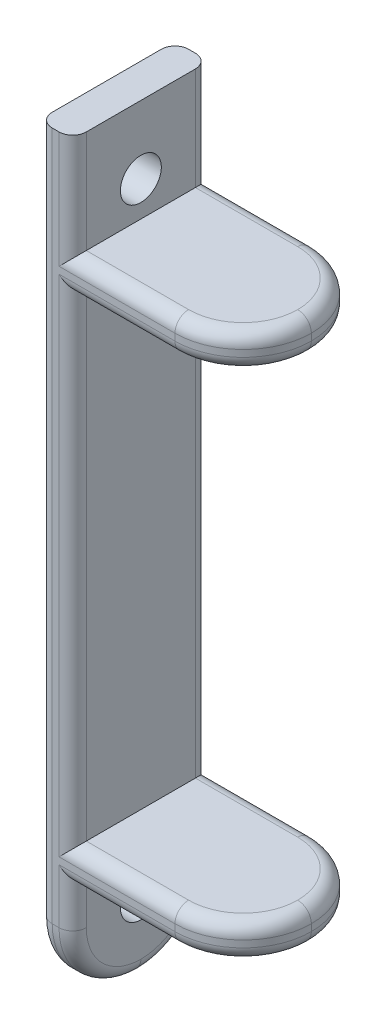
from build123d import *

# Parameters (mm, degrees)
BOSS_EXTRUDE1_DEPTH = 20
SKETCH2_R           = 3
CUT_EXTRUDE1_DEPTH  = 20
FILLET1_R           = 10
FILLET2_R           = 2
CUT_EXTRUDE2_DEPTH  = 10


with BuildPart() as part:
    # Sketch1 → Boss-Extrude1 (new body)
    with BuildSketch(Plane.XY):
        Polygon((0, 0), (5, 0), (5, 10), (5, 16), (30, 16), (30, 21), (5, 21), (5, 91), (30, 91), (30, 96), (5, 96), (5, 170), (0, 170), align=None)
    extrude(amount=BOSS_EXTRUDE1_DEPTH)

    # Sketch2 → Cut-Extrude1 (cut)
    with BuildSketch(Plane.ZY):
        with Locations((10, 10)):
            Circle(SKETCH2_R)
        with Locations((10, 101.100788163)):
            Circle(SKETCH2_R)
    extrude(amount=-CUT_EXTRUDE1_DEPTH, mode=Mode.SUBTRACT)

    # Fillet1
    fillet1_edges = [part.edges().sort_by_distance(p)[0] for p in [
        (2.5, 170, 20),
        (2.5, 170, 0),
        (2.5, 0, 0),
        (2.5, 0, 20),
        (30, 18.5, 20),
        (30, 18.5, 0),
        (30, 93.5, 0),
        (30, 93.5, 20),
    ]]
    fillet(fillet1_edges, radius=FILLET1_R - 0.0001)  # a hair under: the kernel refuses the full size

    # Fillet2
    fillet2_edges = [part.edges().sort_by_distance(p)[0] for p in [
        (5, 56, 0),
        (12.50005, 16, 0),
        (12.50005, 96, 20),
        (5, 128.00005, 0),
        (12.50005, 96, 0),
        (12.50005, 91, 0),
        (5, 128.00005, 20),
        (12.50005, 16, 20),
        (5, 167.071097101, 2.928902899),
        (5, 167.071097101, 17.071097101),
        (0, 85, 20),
        (5, 12.99995, 20),
        (12.50005, 21, 20),
        (0, 85, 0),
        (0, 2.928902899, 17.071097101),
        (0, 2.928902899, 2.928902899),
        (0, 167.071097101, 2.928902899),
        (0, 167.071097101, 17.071097101),
        (12.50005, 91, 20),
        (12.50005, 21, 0),
        (5, 12.99995, 0),
        (5, 2.928902899, 17.071097101),
        (5, 56, 20),
        (5, 2.928902899, 2.928902899),
        (27.071097101, 21, 2.928902899),
        (27.071097101, 21, 17.071097101),
        (27.071097101, 16, 2.928902899),
        (27.071097101, 16, 17.071097101),
        (27.071097101, 96, 17.071097101),
        (27.071097101, 96, 2.928902899),
        (27.071097101, 91, 17.071097101),
        (27.071097101, 91, 2.928902899),
    ]]
    fillet(fillet2_edges, radius=FILLET2_R)

    # Sketch3 → Cut-Extrude2 (cut)
    with BuildSketch(Plane(origin=(5, 0, 0), x_dir=(0, 0, -1), z_dir=(1, 0, 0))):
        with BuildLine():
            Line((-2, 111.064309568), (0, 111.064309568))
            Line((0, 111.064309568), (5.411818178, 111.064309568))
            Line((5.411818178, 111.064309568), (5.411818178, 180.556551252))
            Line((5.411818178, 180.556551252), (-29.02399195, 180.556551252))
            Line((-29.02399195, 180.556551252), (-29.02399195, 111.064309568))
            Line((-29.02399195, 111.064309568), (-20, 111.064309568))
            Line((-20, 111.064309568), (-18, 111.064309568))
            Line((-18, 111.064309568), (-18, 160))
            ThreePointArc((-18, 160), (-15.656854249, 165.656854249), (-10, 168))
            ThreePointArc((-10, 168), (-4.343145751, 165.656854249), (-2, 160))
            Line((-2, 160), (-2, 111.064309568))
        make_face()
        with BuildLine():
            Line((-18, 111.064309568), (-2, 111.064309568))
            Line((-2, 111.064309568), (-2, 160))
            ThreePointArc((-2, 160), (-4.343145751, 165.656854249), (-10, 168))
            ThreePointArc((-10, 168), (-15.656854249, 165.656854249), (-18, 160))
            Line((-18, 160), (-18, 111.064309568))
        make_face()
    extrude(amount=-CUT_EXTRUDE2_DEPTH, mode=Mode.SUBTRACT)


solid = part.part
